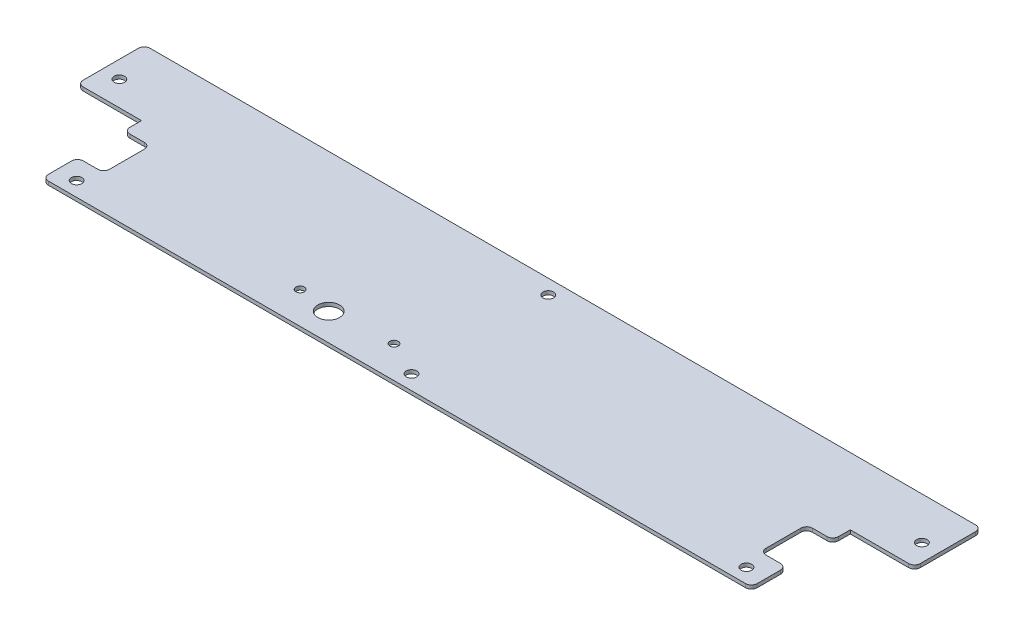
from build123d import *

# Parameters (mm, degrees)
SKETCH1_R           = 2.286
BOSS_EXTRUDE1_DEPTH = 1.5875
FILLET1_R           = 2.54
SKETCH2_W           = 11.43
SKETCH2_H           = 20.32
CUT_EXTRUDE1_DEPTH  = 2.54
FILLET2_R           = 2.54
SKETCH3_R           = 1.830008083
SKETCH3_R_2         = 4.750027573
CUT_EXTRUDE2_DEPTH  = 187.265699175


with BuildPart() as part:
    # Sketch1 → Boss-Extrude1 (new body)
    with BuildSketch(Plane(origin=(0, 0, 0), x_dir=(1, 0, 0), z_dir=(0, 1, 0))):
        Polygon((-154.686, -36.195), (-154.686, 6.985), (-182.708271591, 6.985), (-182.708271591, 36.195), (182.708271591, 36.195), (182.708271591, 6.985), (154.686, 6.985), (154.686, -36.195), align=None)
        with Locations((175.1457, 17.78)):
            Circle(SKETCH1_R, mode=Mode.SUBTRACT)
        with Locations((0, 29.845)):
            Circle(SKETCH1_R, mode=Mode.SUBTRACT)
        with Locations((146.177, -29.845)):
            Circle(SKETCH1_R, mode=Mode.SUBTRACT)
        with Locations((-175.1457, 17.78)):
            Circle(SKETCH1_R, mode=Mode.SUBTRACT)
        with Locations((0, -29.845)):
            Circle(SKETCH1_R, mode=Mode.SUBTRACT)
        with Locations((-146.177, -29.845)):
            Circle(SKETCH1_R, mode=Mode.SUBTRACT)
    extrude(amount=BOSS_EXTRUDE1_DEPTH)

    # Fillet1
    fillet1_edges = [part.edges().sort_by_distance(p)[0] for p in [
        (182.708271591, 0.79375, -6.985),
        (182.708271591, 0.79375, -36.195),
        (154.686, 0.79375, 36.195),
        (-154.686, 0.79375, 36.195),
        (-182.708271591, 0.79375, -36.195),
        (-182.708271591, 0.79375, -6.985),
    ]]
    fillet(fillet1_edges, radius=FILLET1_R)

    # Sketch2 → Cut-Extrude1 (cut)
    with BuildSketch(Plane(origin=(0, 1.5875, 0), x_dir=(1, 0, 0), z_dir=(0, 1, 0))):
        with Locations((-148.971, -10.795)):
            Rectangle(SKETCH2_W, SKETCH2_H)
        with Locations((148.971, -10.795)):
            Rectangle(SKETCH2_W, SKETCH2_H)
    extrude(amount=-CUT_EXTRUDE1_DEPTH, mode=Mode.SUBTRACT)

    # Fillet2
    fillet2_edges = [part.edges().sort_by_distance(p)[0] for p in [
        (154.686, 0.79375, 20.955),
        (143.256, 0.79375, 20.955),
        (143.256, 0.79375, 0.635),
        (154.686, 0.79375, 0.635),
        (-154.686, 0.79375, 20.955),
        (-143.256, 0.79375, 20.955),
        (-143.256, 0.79375, 0.635),
        (-154.686, 0.79375, 0.635),
    ]]
    fillet(fillet2_edges, radius=FILLET2_R)

    # Sketch3 → Cut-Extrude2 (cut, through all)
    with BuildSketch(Plane(origin=(0, 1.5875, 0), x_dir=(1, 0, 0), z_dir=(0, 1, 0))):
        with Locations((-56.253144057, -22.225)):
            Circle(SKETCH3_R)
        with Locations((-15.252601252, -22.225)):
            Circle(SKETCH3_R)
        with Locations((-41.775144057, -24.225056525)):
            Circle(SKETCH3_R_2)
    extrude(amount=-CUT_EXTRUDE2_DEPTH, mode=Mode.SUBTRACT)


solid = part.part
